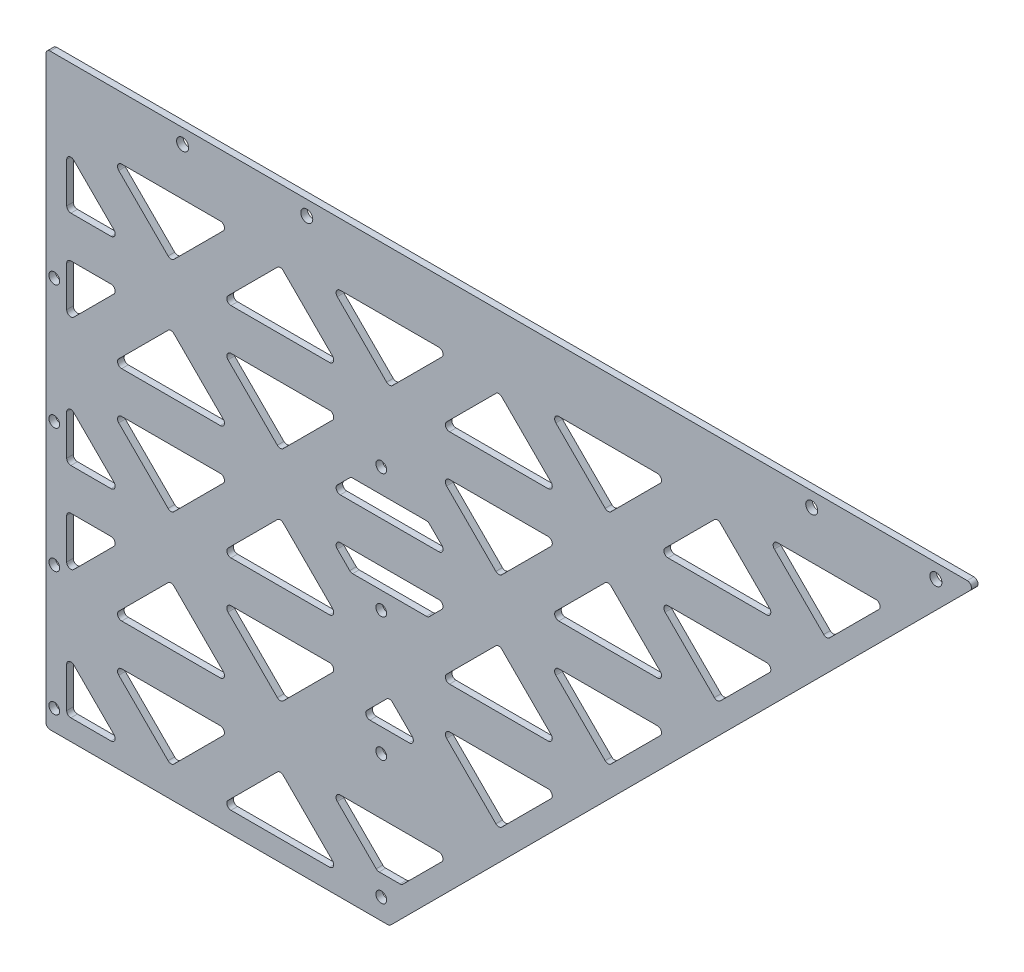
from build123d import *

# Parameters (mm, degrees)
MAIN_SHAPE_DEPTH        = 0.79375
BODY_FASTENERS_D        = 2.6
M2_5_CLEARANCE_HOLE1_D  = 2.9
CUT_EXTRUDE1_DEPTH      = 159.768763163
CUT_EXTRUDE1_DEPTH_BACK = 159.768763163
FILLET1_R               = 1
FILLET2_R               = 1


with BuildPart() as part:
    # Sketch1 → Main Shape (new, symmetric)
    with BuildSketch(Plane.XY):
        Polygon((0, -71), (142, 71), (-83, 71), (-83, -71), align=None)
    extrude(amount=MAIN_SHAPE_DEPTH, both=True)

    # Body fasteners (through all)
    with Locations(Plane(origin=(0, 0, -0.79375), x_dir=(-1, 0, 0), z_dir=(0, 0, -1))):
        with Locations((81, -66), (81, -36), (81, -6), (81, 24), (2, 24), (2, -6), (2, -36), (2, -66)):
            Hole(BODY_FASTENERS_D / 2)

    # M2.5 Clearance Hole1 (through all)
    with Locations(Plane.XY.offset(0.79375)):
        with Locations((132, 67.5), (-50, 67.5), (-20, 67.5), (102, 67.5)):
            Hole(M2_5_CLEARANCE_HOLE1_D / 2)

    # Sketch13 → Cut-Extrude1 (cut, two sides: drawn at the far end of the back side and taken through both)
    with BuildSketch(Plane.XY.offset(0.79375).offset(-CUT_EXTRUDE1_DEPTH_BACK)):
        Polygon((40.728932188, 39.6), (26.4, 53.928932188), (12.071067812, 39.6), align=None)
        Polygon((67.128932188, 56), (38.471067812, 56), (52.8, 41.671067812), align=None)
        Polygon((93.528932188, 39.6), (79.2, 53.928932188), (64.871067812, 39.6), align=None)
        Polygon((-38.471067812, 56), (-67.128932188, 56), (-52.8, 41.671067812), align=None)
        Polygon((119.928932188, 56), (91.271067812, 56), (105.6, 41.671067812), align=None)
        Polygon((-12.071067812, 39.6), (-26.4, 53.928932188), (-40.728932188, 39.6), align=None)
        Polygon((14.328932188, 56), (-14.328932188, 56), (0, 41.671067812), align=None)
        Polygon((-64.871067812, 39.6), (-78, 52.728932188), (-78, 39.6), align=None)
        Polygon((-78, 16.471067812), (-64.871067812, 29.6), (-78, 29.6), align=None)
        Polygon((-67.128932188, 13.2), (-38.471067812, 13.2), (-52.8, 27.528932188), align=None)
        Polygon((-14.328932188, 13.2), (14.328932188, 13.2), (9.328932188, 18.2), (-9.328932188, 18.2), align=None)
        Polygon((-26.4, 15.271067812), (-12.071067812, 29.6), (-40.728932188, 29.6), align=None)
        Polygon((26.4, 15.271067812), (40.728932188, 29.6), (12.071067812, 29.6), align=None)
        Polygon((52.8, 27.528932188), (38.471067812, 13.2), (67.128932188, 13.2), align=None)
        Polygon((93.528932188, 29.6), (64.871067812, 29.6), (79.2, 15.271067812), align=None)
        Polygon((-9.328932188, -1.8), (9.328932188, -1.8), (14.328932188, 3.2), (-14.328932188, 3.2), align=None)
        Polygon((-38.471067812, 3.2), (-67.128932188, 3.2), (-52.8, -11.128932188), align=None)
        Polygon((-12.071067812, -13.2), (-26.4, 1.128932188), (-40.728932188, -13.2), align=None)
        Polygon((-64.871067812, -13.2), (-78, -0.071067812), (-78, -13.2), align=None)
        Polygon((38.471067812, 3.2), (52.8, -11.128932188), (67.128932188, 3.2), align=None)
        Polygon((26.4, 1.128932188), (12.071067812, -13.2), (40.728932188, -13.2), align=None)
        Polygon((12.071067812, -23.2), (26.4, -37.528932188), (40.728932188, -23.2), align=None)
        Polygon((-26.4, -37.528932188), (-12.071067812, -23.2), (-40.728932188, -23.2), align=None)
        Polygon((-67.128932188, -39.6), (-38.471067812, -39.6), (-52.8, -25.271067812), align=None)
        Polygon((-78, -36.328932188), (-64.871067812, -23.2), (-78, -23.2), align=None)
        Polygon((7.164466094, -30.364466094), (0, -23.2), (-7.164466094, -30.364466094), align=None)
        Polygon((-26.4, -51.671067812), (-40.728932188, -66), (-12.071067812, -66), align=None)
        Polygon((-78, -52.871067812), (-78, -66), (-64.871067812, -66), align=None)
        Polygon((-67.128932188, -49.6), (-52.8, -63.928932188), (-38.471067812, -49.6), align=None)
        Polygon((-2.928932188, -61), (2.928932188, -61), (14.328932188, -49.6), (-14.328932188, -49.6), align=None)
    extrude(amount=CUT_EXTRUDE1_DEPTH + CUT_EXTRUDE1_DEPTH_BACK, mode=Mode.SUBTRACT)

    # Fillet1
    fillet1_edges = [part.edges().sort_by_distance(p)[0] for p in [
        (0, -71, 0),
        (-83, -71, 0),
        (-83, 71, 0),
        (142, 71, 0),
    ]]
    fillet(fillet1_edges, radius=FILLET1_R)

    # Fillet2
    fillet2_edges = [part.edges().sort_by_distance(p)[0] for p in [
        (-40.728932188, -13.2, 0),
        (-12.071067812, -13.2, 0),
        (-26.4, 1.128932188, 0),
        (0, -23.2, 0),
        (7.164466094, -30.364466094, 0),
        (-7.164466094, -30.364466094, 0),
        (12.071067812, -23.2, 0),
        (40.728932188, -23.2, 0),
        (26.4, -37.528932188, 0),
        (12.071067812, -13.2, 0),
        (40.728932188, -13.2, 0),
        (26.4, 1.128932188, 0),
        (38.471067812, 3.2, 0),
        (14.328932188, 3.2, 0),
        (-14.328932188, 3.2, 0),
        (9.328932188, -1.8, 0),
        (-9.328932188, -1.8, 0),
        (-26.4, 15.271067812, 0),
        (-14.328932188, 13.2, 0),
        (14.328932188, 13.2, 0),
        (9.328932188, 18.2, 0),
        (-12.071067812, 29.6, 0),
        (-9.328932188, 18.2, 0),
        (-40.728932188, 29.6, 0),
        (-52.8, -11.128932188, 0),
        (-67.128932188, 3.2, 0),
        (-38.471067812, 3.2, 0),
        (-12.071067812, -23.2, 0),
        (-40.728932188, -23.2, 0),
        (-26.4, -37.528932188, 0),
        (-14.328932188, -49.6, 0),
        (14.328932188, -49.6, 0),
        (-2.928932188, -61, 0),
        (2.928932188, -61, 0),
        (-12.071067812, -66, 0),
        (-26.4, -51.671067812, 0),
        (-40.728932188, -66, 0),
        (-38.471067812, -39.6, 0),
        (-52.8, -25.271067812, 0),
        (-67.128932188, -39.6, 0),
        (-38.471067812, -49.6, 0),
        (-67.128932188, -49.6, 0),
        (-52.8, -63.928932188, 0),
        (-64.871067812, -66, 0),
        (-78, -66, 0),
        (-78, -52.871067812, 0),
        (-64.871067812, -23.2, 0),
        (-78, -23.2, 0),
        (-78, -36.328932188, 0),
        (-78, -0.071067812, 0),
        (-78, -13.2, 0),
        (-64.871067812, -13.2, 0),
        (-67.128932188, 13.2, 0),
        (-38.471067812, 13.2, 0),
        (-52.8, 27.528932188, 0),
        (-78, 16.471067812, 0),
        (-64.871067812, 29.6, 0),
        (-78, 29.6, 0),
        (-78, 39.6, 0),
        (-78, 52.728932188, 0),
        (-64.871067812, 39.6, 0),
        (-52.8, 41.671067812, 0),
        (-38.471067812, 56, 0),
        (-67.128932188, 56, 0),
        (-40.728932188, 39.6, 0),
        (-26.4, 53.928932188, 0),
        (-12.071067812, 39.6, 0),
        (-14.328932188, 56, 0),
        (0, 41.671067812, 0),
        (14.328932188, 56, 0),
        (26.4, 53.928932188, 0),
        (40.728932188, 39.6, 0),
        (12.071067812, 39.6, 0),
        (12.071067812, 29.6, 0),
        (26.4, 15.271067812, 0),
        (40.728932188, 29.6, 0),
        (52.8, -11.128932188, 0),
        (67.128932188, 3.2, 0),
        (38.471067812, 13.2, 0),
        (67.128932188, 13.2, 0),
        (52.8, 27.528932188, 0),
        (64.871067812, 29.6, 0),
        (93.528932188, 29.6, 0),
        (79.2, 15.271067812, 0),
        (52.8, 41.671067812, 0),
        (67.128932188, 56, 0),
        (38.471067812, 56, 0),
        (64.871067812, 39.6, 0),
        (79.2, 53.928932188, 0),
        (93.528932188, 39.6, 0),
        (105.6, 41.671067812, 0),
        (91.271067812, 56, 0),
        (119.928932188, 56, 0),
    ]]
    fillet(fillet2_edges, radius=FILLET2_R)


solid = part.part
